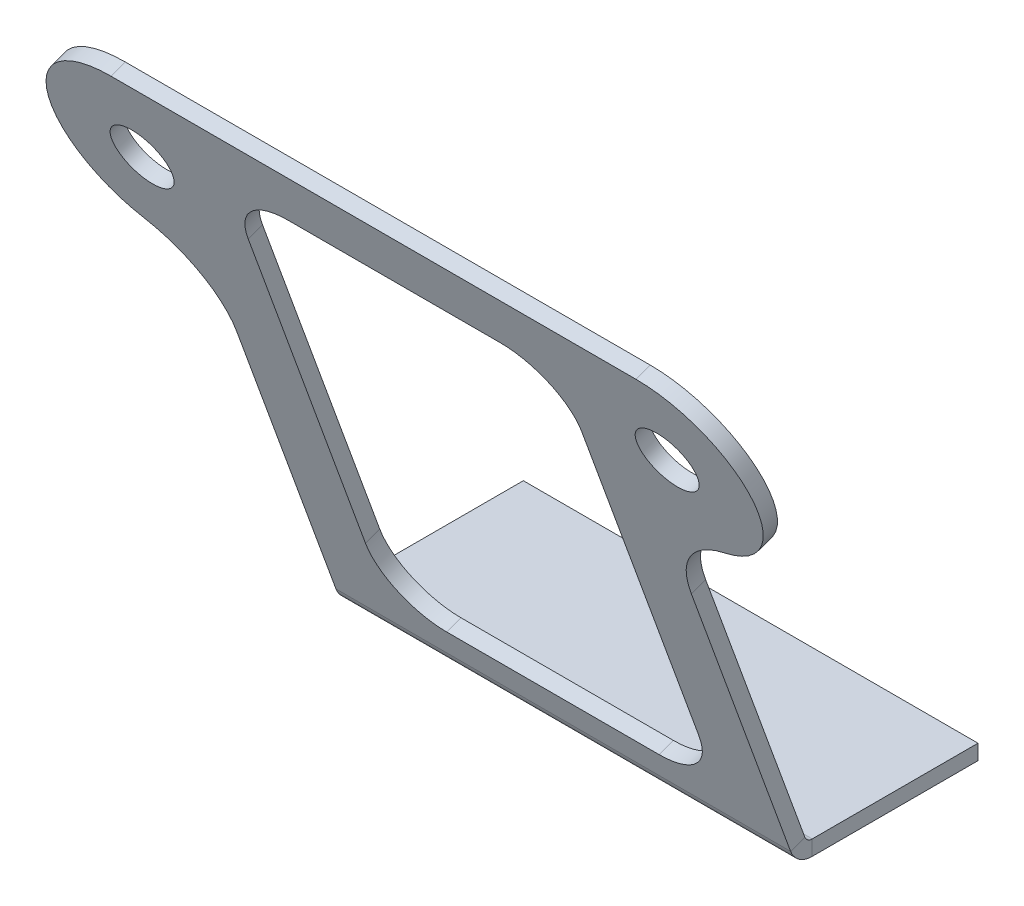
from build123d import *

# Parameters (mm, degrees)
BASE_FLANGE1_DEPTH   = 1.5875
EDGE_FLANGE1_START   = -23.8125
EDGE_FLANGE1_DEPTH   = 47.625
EDGE_FLANGE1_2_DEPTH = 47.625
SKETCH9_R            = 3.175
CUT_EXTRUDE1_DEPTH   = 2.54
CUT_EXTRUDE2_DEPTH   = 2.54


# Read off the part's stored shape, not the designer's step: Edge-Flange1
# Sheet-metal steps are written as plain solids
with BuildPart() as part:
    # Sketch1 → Base-Flange1 (new body)
    with BuildSketch(Plane(origin=(0, 285.976549587, -785.714112483), x_dir=(1, 0, 0), z_dir=(0, -0.34202014332566955, 0.9396926207859082))):
        with BuildLine():
            Line((-27.5, 159.361299231), (27.5, 159.361299231))
            ThreePointArc((27.5, 159.361299231), (36.907682688, 151.326645312), (30.443979637, 140.777678536))
            ThreePointArc((30.443979637, 140.777678536), (25.645376408, 137.290929389), (23.8125, 131.64960183))
            Line((23.8125, 131.64960183), (23.8125, 98.987567929))
            Line((23.8125, 98.987567929), (-23.8125, 98.987567929))
            Line((-23.8125, 98.987567929), (-23.8125, 131.64960183))
            ThreePointArc((-23.8125, 131.64960183), (-25.645376408, 137.290929389), (-30.443979637, 140.777678536))
            ThreePointArc((-30.443979637, 140.777678536), (-36.907682688, 151.326645312), (-27.5, 159.361299231))
        make_face()
    extrude(amount=BASE_FLANGE1_DEPTH)

    # Edge-Flange1 outline → Edge-Flange1 (cut)
    with BuildSketch(Plane.YZ.offset(EDGE_FLANGE1_START)):
        with BuildLine():
            Line((378.994436719, -751.858370313), (378.994436719, -751.849696253))
            ThreePointArc((378.994436719, -751.849696253), (379.428526068, -750.472940733), (380.573785769, -749.594152055))
            Line((380.573785769, -749.594152055), (378.451479742, -750.366608277))
            Line((378.451479742, -750.366608277), (378.994436719, -751.858370313))
        make_face()
    extrude(amount=EDGE_FLANGE1_DEPTH, mode=Mode.SUBTRACT)

    # Edge-Flange1 2 outline → Edge-Flange1 2 (add)
    with BuildSketch(Plane.YZ.offset(EDGE_FLANGE1_START)):
        with BuildLine():
            Line((381.116742747, -751.085914091), (378.994436719, -751.858370313))
            Line((378.994436719, -751.858370313), (378.994436719, -769.218988099))
            Line((378.994436719, -769.218988099), (380.581936719, -769.218988099))
            Line((380.581936719, -769.218988099), (380.581936719, -751.849696253))
            ThreePointArc((380.581936719, -751.849696253), (380.728929938, -751.383493326), (381.116742747, -751.085914091))
        make_face()
    extrude(amount=EDGE_FLANGE1_2_DEPTH)

    # Sketch9 → Cut-Extrude1 (cut)
    with BuildSketch(Plane(origin=(0, 285.433592609, -784.222350448), x_dir=(1, 0, 0), z_dir=(0, -0.34202014332566955, 0.9396926207859082))):
        with Locations(Location((-27.5, 149.836299231, 0), (0, 0, 270))):
            Circle(SKETCH9_R)
        with Locations(Location((27.5, 149.836299231, 0), (0, 0, 270))):
            Circle(SKETCH9_R)
    extrude(amount=-CUT_EXTRUDE1_DEPTH, mode=Mode.SUBTRACT)

    # Sketch10 → Cut-Extrude2 (cut)
    with BuildSketch(Plane(origin=(0, 285.976549587, -785.714112483), x_dir=(-1, 0, 0), z_dir=(0, 0.34202014332566955, -0.9396926207859082))):
        with BuildLine():
            Line((-11.1125, 153.011299231), (11.1125, 153.011299231))
            ThreePointArc((11.1125, 153.011299231), (15.602628061, 151.151427292), (17.4625, 146.661299231))
            Line((17.4625, 146.661299231), (17.4625, 110.77107883))
            ThreePointArc((17.4625, 110.77107883), (15.602628061, 106.28095077), (11.1125, 104.42107883))
            Line((11.1125, 104.42107883), (-11.1125, 104.42107883))
            ThreePointArc((-11.1125, 104.42107883), (-15.602628061, 106.28095077), (-17.4625, 110.77107883))
            Line((-17.4625, 110.77107883), (-17.4625, 146.661299231))
            ThreePointArc((-17.4625, 146.661299231), (-15.602628061, 151.151427292), (-11.1125, 153.011299231))
        make_face()
    extrude(amount=-CUT_EXTRUDE2_DEPTH, mode=Mode.SUBTRACT)


solid = part.part
